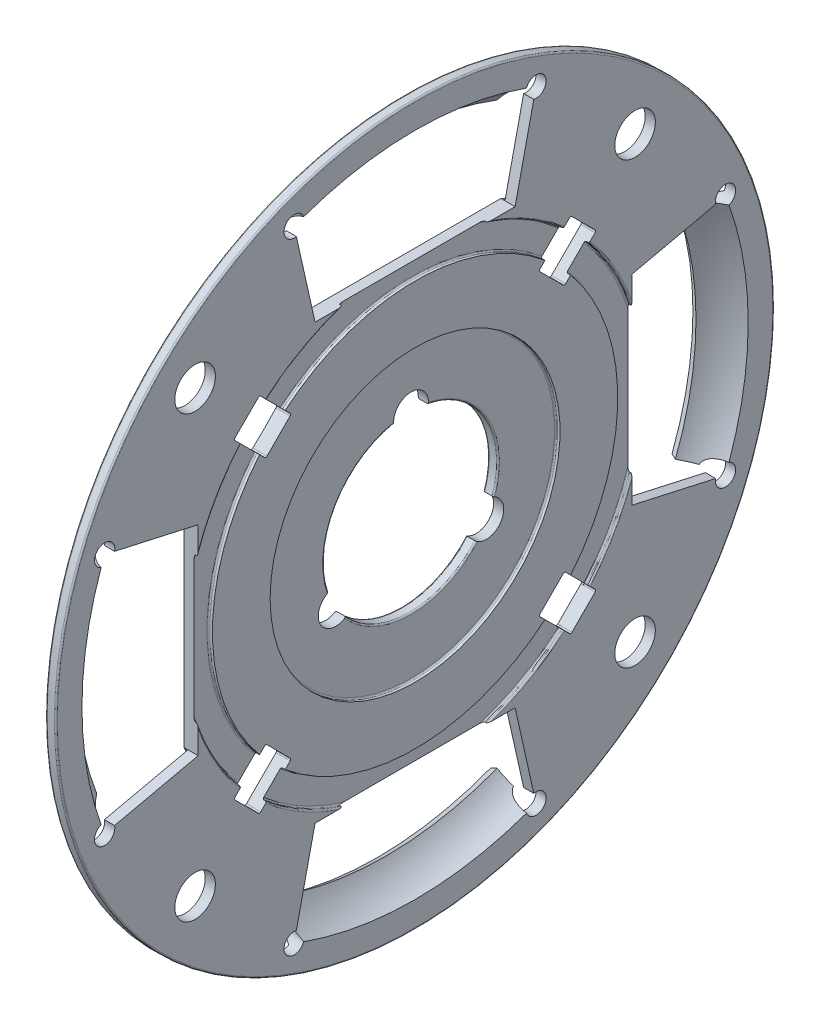
from build123d import *

# Parameters (mm, degrees)
THICKEN1_T1        = 1.75
FILLET1_R          = 0.25
SKETCH3_R          = 3.5
CUT_EXTRUDE1_DEPTH = 88.628006509
CIRPATTERN1_COUNT  = 4
REVOLVE2_ANGLE     = 42
CIRPATTERN2_COUNT  = 4
SKETCH7_R          = 1.75
CUT_EXTRUDE2_DEPTH = 88.737753581
CIRPATTERN3_COUNT  = 4
SKETCH8_R          = 3
CUT_EXTRUDE3_DEPTH = 10
CIRPATTERN4_COUNT  = 3


# Read off the part's stored shape, not the designer's step: Revolve2
with BuildPart() as body_1:
    # Surface-Revolve1: a surface, the sketch's curves turned about an axis
    with BuildLine(Plane.XY, mode=Mode.PRIVATE) as surface_revolve1_1_path:
        Line((0, 15), (0, 26.75))
        Line((0, 26.75), (0.7, 26.75))
        Line((0.7, 26.75), (0.7, 33.2))
        Line((0.7, 33.2), (0, 33.2))
        Line((0, 33.2), (0, 41.2))
        Line((0, 41.2), (0.7, 41.2))
        Line((0.7, 41.2), (0.7, 61.95))
    surface_revolve1_1 = Shell.revolve(surface_revolve1_1_path.wire(), 360, Axis((0, 0, 0), (-1, 0, 0)))
    add(Solid.thicken(surface_revolve1_1, THICKEN1_T1))

    # Fillet1
    fillet1_edges = [body_1.edges().sort_by_distance(p)[0] for p in [
        (1.75, -15, 0),
        (1.75, -25, 0),
        (1.75, -34.95, 0),
        (1.75, -39.45, 0),
        (2.45, -61.95, 0),
        (2.45, -39.45, 0),
        (0.7, -61.95, 0),
        (0.7, -41.2, 0),
        (0, -33.2, 0),
        (0.7, -33.2, 0),
        (0.7, -26.75, 0),
        (0, -26.75, 0),
        (0, -15, 0),
    ]]
    fillet(fillet1_edges, radius=FILLET1_R)

    # Sketch3 → Cut-Extrude1 (cut, symmetric)
    with BuildSketch(Plane.ZY.offset(-0.7)):
        with Locations((37.936278811, 37.936278811)):
            Circle(SKETCH3_R)
        with BuildLine():
            Line((25.54685345, 21.551700137), (21.551700137, 25.54685345))
            ThreePointArc((21.551700137, 25.54685345), (21.463832171, 25.758985485), (21.551700137, 25.971117519))
            Line((21.551700137, 25.971117519), (26.627035113, 31.046452496))
            ThreePointArc((26.627035113, 31.046452496), (26.839167148, 31.134320461), (27.051299182, 31.046452496))
            Line((27.051299182, 31.046452496), (31.046452496, 27.051299182))
            ThreePointArc((31.046452496, 27.051299182), (31.134320461, 26.839167148), (31.046452496, 26.627035113))
            Line((31.046452496, 26.627035113), (25.971117519, 21.551700137))
            ThreePointArc((25.971117519, 21.551700137), (25.758985485, 21.463832171), (25.54685345, 21.551700137))
        make_face()
        with BuildLine():
            Line((-17.25, 37.414936857), (17.25, 37.414936857))
            Line((17.25, 37.414936857), (20.852584577, 53.531973777))
            ThreePointArc((20.852584577, 53.531973777), (0, 57.45), (-20.852584577, 53.531973777))
            Line((-20.852584577, 53.531973777), (-17.25, 37.414936857))
        make_face()
    cut_extrude1 = extrude(amount=CUT_EXTRUDE1_DEPTH, both=True, mode=Mode.SUBTRACT)

    # CirPattern1: Cut-Extrude1 ×4 about axis
    cirpattern1_axis = Axis((0, 0, 0), (1, 0, 0))
    for i in range(1, CIRPATTERN1_COUNT):
        add(cut_extrude1.rotate(cirpattern1_axis, i * 360 / CIRPATTERN1_COUNT), mode=Mode.SUBTRACT)

    # Revolve2 outline → Revolve2 (revolve)
    with BuildSketch(Plane(origin=(0, 0, 0), x_dir=(0, 0.9335804264972016, -0.35836794954530055), z_dir=(0, -0.35836794954530055, -0.9335804264972016))):
        with BuildLine():
            Line((57.45, 0.7), (57.45, 2.45))
            ThreePointArc((57.45, 2.45), (55.861012124, -0.3788097), (53.45, -2.55))
            Line((53.45, -2.55), (54.394593295, -4.023174636))
            ThreePointArc((54.394593295, -4.023174636), (56.823551255, -1.950303633), (58.604708638, 0.7))
            Line((58.604708638, 0.7), (57.45, 0.7))
        make_face()
    revolve2 = revolve(axis=Axis((0, 0, 0), (1, 0, 0)), revolution_arc=REVOLVE2_ANGLE)

    # CirPattern2: Revolve2 ×4 about axis
    cirpattern2_axis = Axis((0, 0, 0), (1, 0, 0))
    for i in range(1, CIRPATTERN2_COUNT):
        add(revolve2.rotate(cirpattern2_axis, i * 360 / CIRPATTERN2_COUNT))

    # Sketch7 → Cut-Extrude2 (cut, symmetric)
    with BuildSketch(Plane.ZY.offset(-0.7)):
        with Locations((20.852584577, 53.531973777)):
            Circle(SKETCH7_R)
        with Locations((-20.852584577, 53.531973777)):
            Circle(SKETCH7_R)
    cut_extrude2 = extrude(amount=CUT_EXTRUDE2_DEPTH, both=True, mode=Mode.SUBTRACT)

    # CirPattern3: Cut-Extrude2 ×4 about axis
    cirpattern3_axis = Axis((0, 0, 0), (1, 0, 0))
    for i in range(1, CIRPATTERN3_COUNT):
        add(cut_extrude2.rotate(cirpattern3_axis, i * 360 / CIRPATTERN3_COUNT), mode=Mode.SUBTRACT)

    # Sketch8 → Cut-Extrude3 (cut)
    with BuildSketch(Plane.ZY):
        with Locations((0, 15)):
            Circle(SKETCH8_R)
    cut_extrude3 = extrude(amount=-CUT_EXTRUDE3_DEPTH, mode=Mode.SUBTRACT)

    # CirPattern4: Cut-Extrude3 ×3 about axis
    cirpattern4_axis = Axis((0, 0, 0), (1, 0, 0))
    for i in range(1, CIRPATTERN4_COUNT):
        add(cut_extrude3.rotate(cirpattern4_axis, i * 360 / CIRPATTERN4_COUNT), mode=Mode.SUBTRACT)


solid = body_1.part
